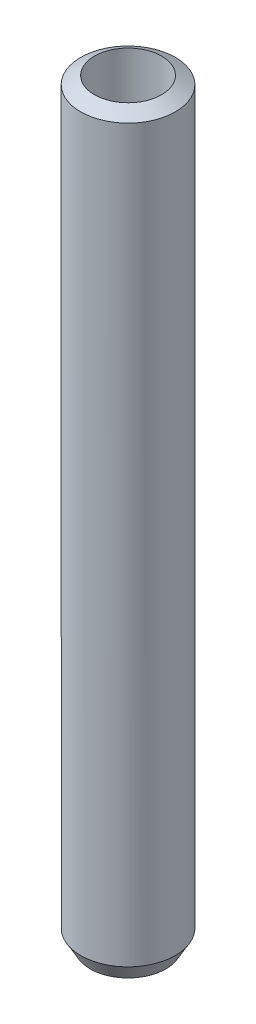
from build123d import *

# Parameters (mm, degrees)
SKETCH1_R           = 17.5
BOSS_EXTRUDE1_DEPTH = 279.982262
SKETCH2_R           = 12.415069034
CUT_EXTRUDE1_DEPTH  = 282.073952964
CHAMFER1_SIZE       = 3.490287
CHAMFER1_SIZE_2     = 6.045354


with BuildPart() as part:
    # Sketch1 → Boss-Extrude1 (new body)
    with BuildSketch(Plane(origin=(0, 0, 0), x_dir=(1, 0, 0), z_dir=(0, 1, 0))):
        with Locations(Location((0, 0, 0), (0, 0, 270))):
            Circle(SKETCH1_R)
    extrude(amount=BOSS_EXTRUDE1_DEPTH)

    # Sketch2 → Cut-Extrude1 (cut, through all)
    with BuildSketch(Plane(origin=(0, 0, 0), x_dir=(1, 0, 0), z_dir=(0, 1, 0))):
        with Locations(Location((0, 0, 0), (0, 0, 270))):
            Circle(SKETCH2_R)
    extrude(amount=CUT_EXTRUDE1_DEPTH, mode=Mode.SUBTRACT)

    # Chamfer1
    # the kernel refuses this chamfer: 6.045354, 3.490287 mm, written as the material it takes off along each edge
    with BuildSketch(Plane(origin=(0, 279.982262, 0), x_dir=(0, 0, 1), z_dir=(-1, 0, 0))) as chamfer1_piece_1:
        Polygon((17.5, -CHAMFER1_SIZE), (17.5 - CHAMFER1_SIZE_2, 0), (17.5, 0), align=None)
    revolve(axis=Axis((0, 279.982262, 0), (0, 1, 0)), mode=Mode.SUBTRACT)
    with BuildSketch(Plane(origin=(0, 0, 0), x_dir=(0, 0, 1), z_dir=(-1, 0, 0))) as chamfer1_piece_2:
        Polygon((17.5, CHAMFER1_SIZE_2), (17.5 - CHAMFER1_SIZE, 0), (17.5, 0), align=None)
    revolve(axis=Axis((0, 0, 0), (0, 1, 0)), mode=Mode.SUBTRACT)


solid = part.part
